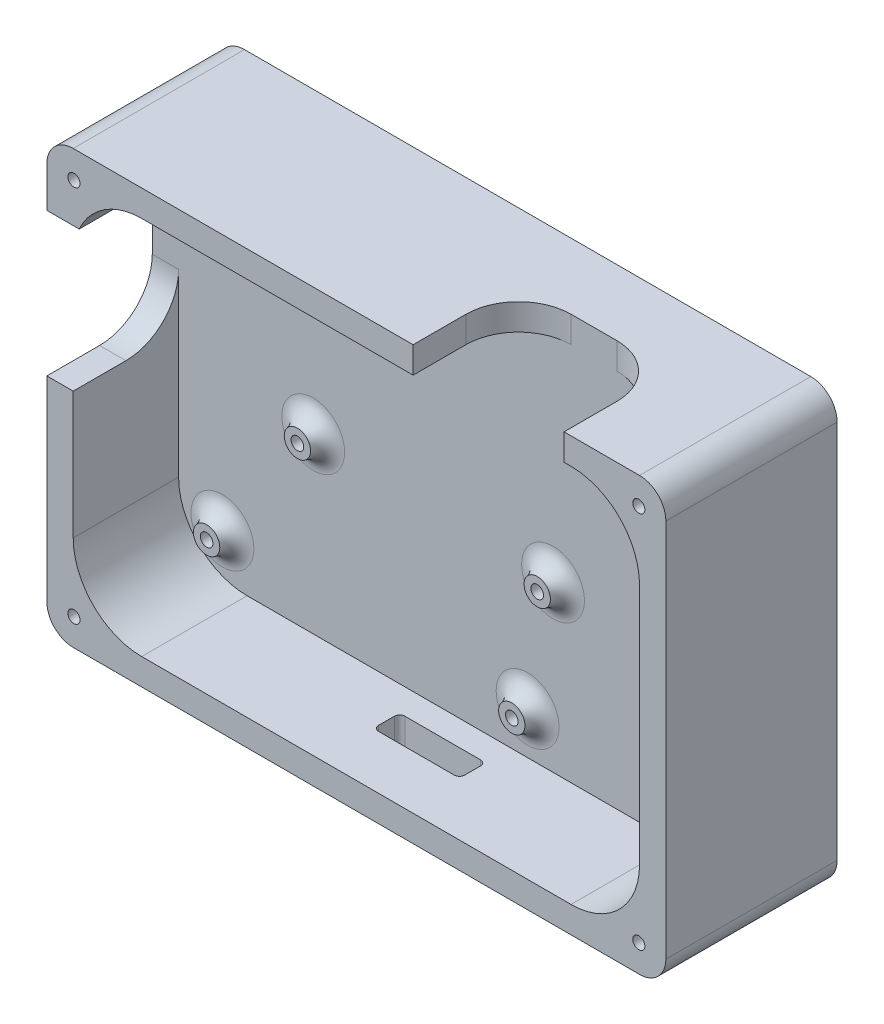
from build123d import *

# Parameters (mm, degrees)
SKETCH1_W                       = 107.4598
SKETCH1_H                       = 72.0014
BOSS_EXTRUDE1_DEPTH             = 5
SKETCH2_R                       = 2.5
BOSS_EXTRUDE2_DEPTH             = 3
FILLET1_R                       = 3.5
SKETCH3_W                       = 10
SKETCH3_H                       = 18
CUT_EXTRUDE1_DEPTH              = 1144.403085918
SKETCH4_W                       = 117.4598
SKETCH4_H                       = 82.0014
SKETCH4_W_2                     = 107.4598
SKETCH4_H_2                     = 72.0014
BOSS_EXTRUDE3_DEPTH             = 25
FILLET2_R                       = 13
FILLET4_R                       = 5
CUT_EXTRUDE2_REACH              = 1581.821
SKETCH5_W                       = 20
SKETCH5_H                       = 27.2
CUT_EXTRUDE3_REACH              = 1471.989
SKETCH6_W                       = 28.64
SKETCH6_H                       = 20
CUT_EXTRUDE4_REACH              = 1471.989
SKETCH7_W                       = 16.345
SKETCH7_H                       = 5
FILLET6_R                       = 10
BOSS_EXTRUDE4_DEPTH             = 7.5
M2_5_CLEARANCE_HOLE1_AT_2_COUNT = 2
M2_5_CLEARANCE_HOLE1_AT_2_PITCH = 128.97404159
M2_5_CLEARANCE_HOLE1_AT_3_COUNT = 2
M2_5_CLEARANCE_HOLE1_AT_3_PITCH = 71.729322061
M2_5_CLEARANCE_HOLE1_AT_4_COUNT = 2
M2_5_CLEARANCE_HOLE1_AT_4_PITCH = 107.187722061
FILLET7_R                       = 10
FILLET9_R                       = 3
FILLET10_R                      = 1
M2_5_CLEARANCE_HOLE2_D          = 2.4
M2_5_CLEARANCE_HOLE2_DEPTH      = 7
M2_5_CLEARANCE_HOLE2_TIP        = 0.721032743


with BuildPart() as part:
    # Sketch1 → Boss-Extrude1 (new body)
    with BuildSketch(Plane(origin=(0, 0, 1267.000672028), x_dir=(-1, 0, 0), z_dir=(0, 0, -1))):
        with Locations((-646.799673216, 867.660704475)):
            Rectangle(SKETCH1_W, SKETCH1_H)
    extrude(amount=BOSS_EXTRUDE1_DEPTH)

    # Sketch2 → Boss-Extrude2 (add)
    with BuildSketch(Plane.XY.offset(1267.000672028)):
        with Locations(Location((692.059773216, 895.874704475, 0), (0, 0, 180))):
            Circle(SKETCH2_R)
        with Locations(Location((601.379773216, 839.996804475, 0), (0, 0, 180))):
            Circle(SKETCH2_R)
        with Locations(Location((692.059773216, 862.854704475, 0), (0, 0, 180))):
            Circle(SKETCH2_R)
        with Locations(Location((664.119773216, 862.854704475, 0), (0, 0, 180))):
            Circle(SKETCH2_R)
        with Locations(Location((602.019473216, 895.232404475, 0), (0, 0, 180))):
            Circle(SKETCH2_R)
        with Locations(Location((618.614473216, 864.477404475, 0), (0, 0, 180))):
            Circle(SKETCH2_R)
        with Locations(Location((659.296473216, 839.669904475, 0), (0, 0, 180))):
            Circle(SKETCH2_R)
    extrude(amount=BOSS_EXTRUDE2_DEPTH)

    # Fillet1
    # the kernel refuses this fillet: 3.5 mm, written as the material it adds along each edge
    with BuildSketch(Plane(origin=(692.059773216, 895.874704475, 1267.000672028), x_dir=(-1, 0, 0), z_dir=(0, 1, 0))) as fillet1_piece_1:
        with BuildLine():
            CenterArc((5.964101615, 3.5), FILLET1_R, 188.213210702, 81.786789298)
            Line((2.5, 3), (2.430717968, 2.99))
            ThreePointArc((2.430717968, 2.99), (2.43, 1.5), (2.43, 0))
            Line((2.43, 0), (2.5, -0.07))
            Line((2.5, -0.07), (5.964101615, -0.07))
            Line((5.964101615, -0.07), (5.964101615, 0))
        make_face()
    revolve(axis=Axis((692.059773216, 895.874704475, 1267.000672028), (0, 0, 1)))
    with BuildSketch(Plane(origin=(659.296473216, 839.669904475, 1267.000672028), x_dir=(-1, 0, 0), z_dir=(0, 1, 0))) as fillet1_piece_2:
        with BuildLine():
            CenterArc((5.964101615, 3.5), FILLET1_R, 188.213210702, 81.786789298)
            Line((2.5, 3), (2.430717968, 2.99))
            ThreePointArc((2.430717968, 2.99), (2.43, 1.5), (2.43, 0))
            Line((2.43, 0), (2.5, -0.07))
            Line((2.5, -0.07), (5.964101615, -0.07))
            Line((5.964101615, -0.07), (5.964101615, 0))
        make_face()
    revolve(axis=Axis((659.296473216, 839.669904475, 1267.000672028), (0, 0, 1)))
    with BuildSketch(Plane(origin=(618.614473216, 864.477404475, 1267.000672028), x_dir=(-1, 0, 0), z_dir=(0, 1, 0))) as fillet1_piece_3:
        with BuildLine():
            CenterArc((5.964101615, 3.5), FILLET1_R, 188.213210702, 81.786789298)
            Line((2.5, 3), (2.430717968, 2.99))
            ThreePointArc((2.430717968, 2.99), (2.43, 1.5), (2.43, 0))
            Line((2.43, 0), (2.5, -0.07))
            Line((2.5, -0.07), (5.964101615, -0.07))
            Line((5.964101615, -0.07), (5.964101615, 0))
        make_face()
    revolve(axis=Axis((618.614473216, 864.477404475, 1267.000672028), (0, 0, 1)))
    with BuildSketch(Plane(origin=(601.379773216, 839.996804475, 1267.000672028), x_dir=(-1, 0, 0), z_dir=(0, 1, 0))) as fillet1_piece_4:
        with BuildLine():
            CenterArc((5.964101615, 3.5), FILLET1_R, 188.213210702, 81.786789298)
            Line((2.5, 3), (2.430717968, 2.99))
            ThreePointArc((2.430717968, 2.99), (2.43, 1.5), (2.43, 0))
            Line((2.43, 0), (2.5, -0.07))
            Line((2.5, -0.07), (5.964101615, -0.07))
            Line((5.964101615, -0.07), (5.964101615, 0))
        make_face()
    revolve(axis=Axis((601.379773216, 839.996804475, 1267.000672028), (0, 0, 1)))
    with BuildSketch(Plane(origin=(692.059773216, 862.854704475, 1267.000672028), x_dir=(-1, 0, 0), z_dir=(0, 1, 0))) as fillet1_piece_5:
        with BuildLine():
            CenterArc((5.964101615, 3.5), FILLET1_R, 188.213210702, 81.786789298)
            Line((2.5, 3), (2.430717968, 2.99))
            ThreePointArc((2.430717968, 2.99), (2.43, 1.5), (2.43, 0))
            Line((2.43, 0), (2.5, -0.07))
            Line((2.5, -0.07), (5.964101615, -0.07))
            Line((5.964101615, -0.07), (5.964101615, 0))
        make_face()
    revolve(axis=Axis((692.059773216, 862.854704475, 1267.000672028), (0, 0, 1)))
    with BuildSketch(Plane(origin=(664.119773216, 862.854704475, 1267.000672028), x_dir=(-1, 0, 0), z_dir=(0, 1, 0))) as fillet1_piece_6:
        with BuildLine():
            CenterArc((5.964101615, 3.5), FILLET1_R, 188.213210702, 81.786789298)
            Line((2.5, 3), (2.430717968, 2.99))
            ThreePointArc((2.430717968, 2.99), (2.43, 1.5), (2.43, 0))
            Line((2.43, 0), (2.5, -0.07))
            Line((2.5, -0.07), (5.964101615, -0.07))
            Line((5.964101615, -0.07), (5.964101615, 0))
        make_face()
    revolve(axis=Axis((664.119773216, 862.854704475, 1267.000672028), (0, 0, 1)))
    with BuildSketch(Plane(origin=(602.019473216, 895.232404475, 1267.000672028), x_dir=(-1, 0, 0), z_dir=(0, 1, 0))) as fillet1_piece_7:
        with BuildLine():
            CenterArc((5.964101615, 3.5), FILLET1_R, 188.213210702, 81.786789298)
            Line((2.5, 3), (2.430717968, 2.99))
            ThreePointArc((2.430717968, 2.99), (2.43, 1.5), (2.43, 0))
            Line((2.43, 0), (2.5, -0.07))
            Line((2.5, -0.07), (5.964101615, -0.07))
            Line((5.964101615, -0.07), (5.964101615, 0))
        make_face()
    revolve(axis=Axis((602.019473216, 895.232404475, 1267.000672028), (0, 0, 1)))

    # Sketch3 → Cut-Extrude1 (cut, through all)
    with BuildSketch(Plane.XY.offset(1267.000672028)):
        with Locations((689.529573216, 846.660004475)):
            Rectangle(SKETCH3_W, SKETCH3_H)
    extrude(amount=-CUT_EXTRUDE1_DEPTH, mode=Mode.SUBTRACT)

    # Sketch4 → Boss-Extrude3 (add)
    with BuildSketch(Plane(origin=(0, 0, 1262.000672028), x_dir=(-1, 0, 0), z_dir=(0, 0, -1))):
        with Locations((-646.799673216, 867.660704475)):
            Rectangle(SKETCH4_W, SKETCH4_H)
        with Locations((-646.799673216, 867.660704475)):
            Rectangle(SKETCH4_W_2, SKETCH4_H_2, mode=Mode.SUBTRACT)
    extrude(amount=-BOSS_EXTRUDE3_DEPTH)

    # Fillet2
    fillet2_edges = [part.edges().sort_by_distance(p)[0] for p in [
        (700.529573216, 903.661404475, 1277.000672028),
        (593.069773216, 903.661404475, 1277.000672028),
        (593.069773216, 831.660004475, 1277.000672028),
        (700.529573216, 831.660004475, 1277.000672028),
    ]]
    fillet(fillet2_edges, radius=FILLET2_R)

    # Fillet4
    fillet4_edges = [part.edges().sort_by_distance(p)[0] for p in [
        (705.529573216, 826.660004475, 1274.500672028),
        (705.529573216, 908.661404475, 1274.500672028),
        (588.069773216, 908.661404475, 1274.500672028),
        (588.069773216, 826.660004475, 1274.500672028),
    ]]
    fillet(fillet4_edges, radius=FILLET4_R)

    # Sketch5 → Cut-Extrude2 (cut, up to next)
    with BuildSketch(Plane.ZY.offset(-588.069773216), mode=Mode.PRIVATE) as cut_extrude2_sk1:
        with Locations((1277.000672028, 882.384904475)):
            Rectangle(SKETCH5_W, SKETCH5_H)
    cut_extrude2_tool1 = extrude(cut_extrude2_sk1.sketch, amount=-CUT_EXTRUDE2_REACH, mode=Mode.PRIVATE) & part.part
    add(cut_extrude2_tool1.solids().sort_by_distance((588.069773, 882.384904, 1277.000672))[0], mode=Mode.SUBTRACT)

    # Sketch6 → Cut-Extrude3 (cut, up to next)
    with BuildSketch(Plane(origin=(0, 908.661404475, 0), x_dir=(1, 0, 0), z_dir=(0, 1, 0)), mode=Mode.PRIVATE) as cut_extrude3_sk1:
        with Locations((671.889773216, -1277.000672028)):
            Rectangle(SKETCH6_W, SKETCH6_H)
    cut_extrude3_tool1 = extrude(cut_extrude3_sk1.sketch, amount=-CUT_EXTRUDE3_REACH, mode=Mode.PRIVATE) & part.part
    add(cut_extrude3_tool1.solids().sort_by_distance((671.889773, 908.661404, 1277.000672))[0], mode=Mode.SUBTRACT)

    # Sketch7 → Cut-Extrude4 (cut, up to next)
    with BuildSketch(Plane.XZ.offset(-826.660004475), mode=Mode.PRIVATE) as cut_extrude4_sk1:
        with Locations((648.011447044, 1274.324843002)):
            Rectangle(SKETCH7_W, SKETCH7_H)
    cut_extrude4_tool1 = extrude(cut_extrude4_sk1.sketch, amount=-CUT_EXTRUDE4_REACH, mode=Mode.PRIVATE) & part.part
    add(cut_extrude4_tool1.solids().sort_by_distance((648.011447, 826.660004, 1274.324843))[0], mode=Mode.SUBTRACT)

    # Fillet6
    fillet6_edges = [part.edges().sort_by_distance(p)[0] for p in [
        (591.139757454, 895.984904475, 1267.000672028),
        (590.569773216, 868.784904475, 1267.000672028),
        (686.209773216, 906.161404475, 1267.000672028),
        (657.569773216, 906.161404475, 1267.000672028),
    ]]
    fillet(fillet6_edges, radius=FILLET6_R)

    # Sketch8 → Boss-Extrude4 (add)
    with BuildSketch(Plane(origin=(0, 0, 1262.000672028), x_dir=(-1, 0, 0), z_dir=(0, 0, -1))):
        with BuildLine():
            Line((-705.529573216, 903.661404475), (-705.529573216, 831.660004475))
            ThreePointArc((-705.529573216, 831.660004475), (-704.065107121, 828.124470569), (-700.529573216, 826.660004475))
            Line((-700.529573216, 826.660004475), (-593.069773216, 826.660004475))
            ThreePointArc((-593.069773216, 826.660004475), (-589.53423931, 828.124470569), (-588.069773216, 831.660004475))
            Line((-588.069773216, 831.660004475), (-588.069773216, 903.661404475))
            ThreePointArc((-588.069773216, 903.661404475), (-589.53423931, 907.19693838), (-593.069773216, 908.661404475))
            Line((-593.069773216, 908.661404475), (-700.529573216, 908.661404475))
            ThreePointArc((-700.529573216, 908.661404475), (-704.065107121, 907.19693838), (-705.529573216, 903.661404475))
        make_face()
        Polygon((-680.529573216, 888.660004475), (-694.529573216, 855.660004475), (-694.529573216, 837.660004475), (-684.529573216, 837.660004475), (-680.529573216, 846.660004475), (-615.529573216, 846.660004475), (-615.529573216, 888.660004475), align=None, mode=Mode.SUBTRACT)
    extrude(amount=BOSS_EXTRUDE4_DEPTH)

    # Sketch11 → M2.5 Clearance Hole1 (revolve, cut)
    with BuildSketch(Plane(origin=(700.393534246, 831.796043444, 1287.000672028), x_dir=(0, -1, 0), z_dir=(1, 0, 0))):
        Polygon((0, 0), (0, 8.690989712), (1.15, 8), (1.15, 0), align=None)
    m2_5_clearance_hole1 = revolve(axis=Axis((700.393534246, 831.796043444, 1293.350672028), (0, 0, -1)), mode=Mode.SUBTRACT)

    # M2.5 Clearance Hole1 at 2: M2.5 Clearance Hole1 ×2
    with Locations(*[Vector(-0.8310798106336571, 0.5561531698706076, 0) * (i * M2_5_CLEARANCE_HOLE1_AT_2_PITCH) for i in range(1, M2_5_CLEARANCE_HOLE1_AT_2_COUNT)]):
        add(m2_5_clearance_hole1, mode=Mode.SUBTRACT)

    # M2.5 Clearance Hole1 at 3: M2.5 Clearance Hole1 ×2
    with Locations(*[(0, i * M2_5_CLEARANCE_HOLE1_AT_3_PITCH, 0) for i in range(1, M2_5_CLEARANCE_HOLE1_AT_3_COUNT)]):
        add(m2_5_clearance_hole1, mode=Mode.SUBTRACT)

    # M2.5 Clearance Hole1 at 4: M2.5 Clearance Hole1 ×2
    with Locations(*[(-i * M2_5_CLEARANCE_HOLE1_AT_4_PITCH, 0, 0) for i in range(1, M2_5_CLEARANCE_HOLE1_AT_4_COUNT)]):
        add(m2_5_clearance_hole1, mode=Mode.SUBTRACT)

    # Mirror1: M2.5 Clearance Hole1 across plane
    add(m2_5_clearance_hole1.mirror(Plane.XY.offset(1270.750672028)), mode=Mode.SUBTRACT)

    # Mirror1 copy 1 sketch → Mirror1 copy 1 (revolve, cut)
    with BuildSketch(Plane(origin=(593.205812185, 903.525365505, 1254.500672028), x_dir=(0, -1, 0), z_dir=(1, 0, 0))):
        Polygon((0, 0), (0, -8.690989712), (1.15, -8), (1.15, 0), align=None)
    revolve(axis=Axis((593.205812185, 903.525365505, 1248.150672028), (0, 0, -1)), mode=Mode.SUBTRACT)

    # Mirror1 copy 2 sketch → Mirror1 copy 2 (revolve, cut)
    with BuildSketch(Plane(origin=(700.393534246, 903.525365505, 1254.500672028), x_dir=(0, -1, 0), z_dir=(1, 0, 0))):
        Polygon((0, 0), (0, -8.690989712), (1.15, -8), (1.15, 0), align=None)
    revolve(axis=Axis((700.393534246, 903.525365505, 1248.150672028), (0, 0, -1)), mode=Mode.SUBTRACT)

    # Mirror1 copy 3 sketch → Mirror1 copy 3 (revolve, cut)
    with BuildSketch(Plane(origin=(593.205812185, 831.796043444, 1254.500672028), x_dir=(0, -1, 0), z_dir=(1, 0, 0))):
        Polygon((0, 0), (0, -8.690989712), (1.15, -8), (1.15, 0), align=None)
    revolve(axis=Axis((593.205812185, 831.796043444, 1248.150672028), (0, 0, -1)), mode=Mode.SUBTRACT)

    # Fillet7
    fillet7_edges = [part.edges().sort_by_distance(p)[0] for p in [
        (680.529573216, 846.660004475, 1258.250672028),
    ]]
    fillet(fillet7_edges, radius=FILLET7_R)

    # Fillet9
    fillet9_edges = [part.edges().sort_by_distance(p)[0] for p in [
        (680.529573216, 888.660004475, 1258.250672028),
        (615.529573216, 846.660004475, 1258.250672028),
        (615.529573216, 888.660004475, 1258.250672028),
    ]]
    fillet(fillet9_edges, radius=FILLET9_R)

    # Fillet10
    fillet10_edges = [part.edges().sort_by_distance(p)[0] for p in [
        (639.838947044, 829.160004475, 1271.824843002),
        (639.838947044, 829.160004475, 1276.824843002),
        (656.183947044, 829.160004475, 1276.824843002),
        (656.183947044, 829.160004475, 1271.824843002),
    ]]
    fillet(fillet10_edges, radius=FILLET10_R)

    # M2.5 Clearance Hole2
    with Locations(Plane.XY.offset(1270.000672028)):
        with Locations((601.379773216, 839.996804475), (659.296473216, 839.669904475), (692.049773216, 862.834704475), (664.109773216, 862.834704475), (692.059773216, 895.874704475), (618.614473216, 864.477404475)):
            Hole(M2_5_CLEARANCE_HOLE2_D / 2, depth=M2_5_CLEARANCE_HOLE2_DEPTH)
            with Locations((0, 0, -(M2_5_CLEARANCE_HOLE2_DEPTH + M2_5_CLEARANCE_HOLE2_TIP / 2))):  # 118° drill point
                Cone(0, M2_5_CLEARANCE_HOLE2_D / 2, M2_5_CLEARANCE_HOLE2_TIP, mode=Mode.SUBTRACT)


solid = part.part
